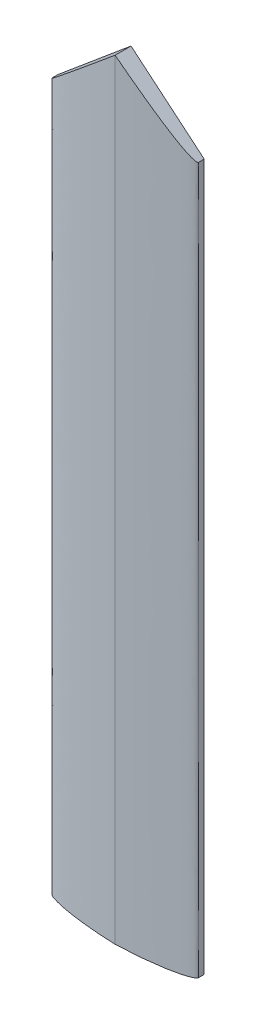
from build123d import *

# Parameters (mm, degrees)
EXTRUDE_1_DEPTH = 3
FILLET_1_SIZE   = 2
FILLET_1_SIZE_2 = 20


with BuildPart() as part:
    # 스케치1 → 보스-돌출1 (new body)
    with BuildSketch(Plane.XY):
        with BuildLine():
            Line((-13.25, 56.84613648), (0, 67.95386352))
            Line((0, 67.95386352), (13.25, 56.84613648))
            Line((13.25, 56.84613648), (13.25, -70.98356682))
            ThreePointArc((13.25, -70.98356682), (0, -71.44613648), (-13.25, -70.98356682))
            Line((-13.25, -70.98356682), (-13.25, 56.84613648))
        make_face()
    extrude(amount=EXTRUDE_1_DEPTH)

    # 필렛1
    # an asymmetric fillet: 20, 2 mm, written as the material it takes off along each edge
    with BuildSketch(Plane(origin=(-13.25, -120.98356682, 3), x_dir=(0, 0, -1), z_dir=(0, 1, 0)), Plane(origin=(13.25, 106.84613648, 3), x_dir=(0, 0, -1), z_dir=(0, -1, 0))) as fillet_1_piece_1:
        with BuildLine():
            Bezier((FILLET_1_SIZE, 0), (0, 0), (0, -FILLET_1_SIZE_2), weights=[1, 0.707106781, 1])
            Line((0, -FILLET_1_SIZE_2), (0, 0))
            Line((0, 0), (FILLET_1_SIZE, 0))
        make_face()
    extrude(amount=227.8297033, mode=Mode.SUBTRACT)


solid = part.part
